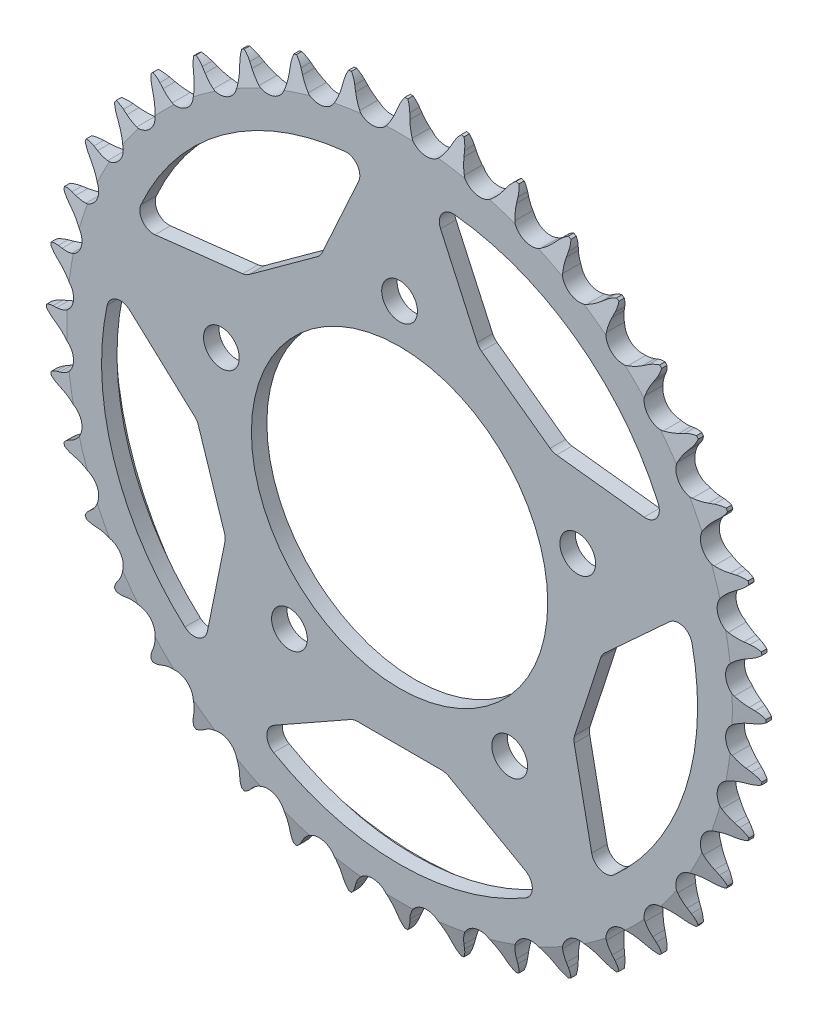
from build123d import *

# Parameters (mm, degrees)
CUT_EXTRUDE1_DEPTH      = 150.392064827
CIRPATTERN1_COUNT       = 40
CUT_EXTRUDE2_DEPTH      = 150.392064971
CUT_EXTRUDE2_DEPTH_BACK = 150.392064971
SKETCH3_OUTSIDE_W       = 272.992
SKETCH3_OUTSIDE_H       = 272.992
SKETCH3_OUTSIDE_R       = 105.664
SKETCH3_OUTSIDE_R_2     = 9.128125
SKETCH4_R               = 43.5
SKETCH4_R_2             = 5.25
CUT_EXTRUDE3_DEPTH      = 150.469008542
SKETCH5_R               = 88.9
CUT_EXTRUDE4_DEPTH      = 1


with BuildPart() as part:
    # Sketch1 → Revolve1 (revolve)
    with BuildSketch(Plane(origin=(0, 0, 0), x_dir=(0, 0, -1), z_dir=(1, 0, 0))):
        Polygon((2.7686, 0), (-2.7686, 0), (-2.7686, 97.680500093), (-0.784225, 105.618000093), (0.784225, 105.618000093), (2.7686, 97.680500093), align=None)
    revolve(axis=Axis((0, 0, -2.7686), (0, 0, 1)))

    # Sketch0 → Cut-Extrude1 (cut, symmetric)
    with BuildSketch(Plane.XY):
        with BuildLine():
            Line((14.490506305, -102.030654901), (13.889358736, -100.705432441))
            ThreePointArc((13.889358736, -100.705432441), (12.971330875, -99.018148468), (11.819348726, -97.481060478))
            ThreePointArc((11.819348726, -97.481060478), (7.533945641, -95.727855787), (3.575564617, -98.129860358))
            ThreePointArc((3.575564617, -98.129860358), (2.678218818, -99.828233955), (2.035442768, -101.63835586))
            Line((2.035442768, -101.63835586), (1.64900679, -103.041302831))
            ThreePointArc((1.64900679, -103.041302831), (-1.504766141, -107.55512866), (-6.798561297, -109.070595641))
            ThreePointArc((-6.798561297, -109.070595641), (8.574188346, -108.945392575), (23.777260006, -106.664226317))
            ThreePointArc((23.777260006, -106.664226317), (18.311568987, -105.995549262), (14.490506305, -102.030654901))
        make_face()
    cut_extrude1 = extrude(amount=CUT_EXTRUDE1_DEPTH, both=True, mode=Mode.SUBTRACT)

    # CirPattern1: Cut-Extrude1 ×40 about axis
    cirpattern1_axis = Axis((0, 0, -2.7686), (0, 0, -1))
    for i in range(1, CIRPATTERN1_COUNT):
        add(cut_extrude1.rotate(cirpattern1_axis, i * 360 / CIRPATTERN1_COUNT), mode=Mode.SUBTRACT)

    # Sketch3 outside → Cut-Extrude2 (cut, two sides: drawn at the far end of the back side and taken through both)
    # profile 1 of 2: a face of its own
    with BuildSketch(Plane.XY.offset(-CUT_EXTRUDE2_DEPTH_BACK)):
        Rectangle(SKETCH3_OUTSIDE_W, SKETCH3_OUTSIDE_H)
        Circle(SKETCH3_OUTSIDE_R, mode=Mode.SUBTRACT)
    # profile 2 of 2: a face of its own
    with BuildSketch(Plane.XY.offset(-CUT_EXTRUDE2_DEPTH_BACK)):
        Circle(SKETCH3_OUTSIDE_R_2)
    extrude(amount=CUT_EXTRUDE2_DEPTH + CUT_EXTRUDE2_DEPTH_BACK, mode=Mode.SUBTRACT)

    # Sketch4 → Cut-Extrude3 (cut, through all)
    with BuildSketch(Plane(origin=(0, 0, -2.7686), x_dir=(-1, 0, 0), z_dir=(0, 0, -1))):
        with BuildLine():
            ThreePointArc((14.396422166, -58.578252267), (13.446033811, -58.192338289), (12.428748275, -58.060817336))
            Line((12.428748275, -58.060817336), (-12.428748275, -58.060817336))
            ThreePointArc((-12.428748275, -58.060817336), (-13.446033811, -58.192338289), (-14.396422166, -58.578252267))
            Line((-14.396422166, -58.578252267), (-36.936123044, -71.313342656))
            ThreePointArc((-36.936123044, -71.313342656), (-38.968386294, -74.773483053), (-36.975046435, -78.256192012))
            ThreePointArc((-36.975046435, -78.256192012), (0, -88.201393135), (36.975046435, -78.256192012))
            ThreePointArc((36.975046435, -78.256192012), (38.968386294, -74.773483053), (36.936123044, -71.313342656))
            Line((36.936123044, -71.313342656), (14.396422166, -58.578252267))
        make_face()
        with BuildLine():
            ThreePointArc((-51.262489424, -31.793486564), (-51.189149573, -30.770359548), (-51.378424233, -29.7622213))
            Line((-51.378424233, -29.7622213), (-59.059813104, -6.121337228))
            ThreePointArc((-59.059813104, -6.121337228), (-59.499255482, -5.194483399), (-60.159967639, -4.409864339))
            Line((-60.159967639, -4.409864339), (-79.236908958, 13.091305701))
            ThreePointArc((-79.236908958, 13.091305701), (-83.155701912, 13.954860722), (-85.851979069, 10.982865605))
            ThreePointArc((-85.851979069, 10.982865605), (-83.884509688, -27.255729406), (-63.000143637, -59.347852099))
            ThreePointArc((-63.000143637, -59.347852099), (-59.071914695, -60.167414706), (-56.409129505, -57.165375314))
            Line((-56.409129505, -57.165375314), (-51.262489424, -31.793486564))
        make_face()
        with BuildLine():
            ThreePointArc((-46.078382978, 38.92879695), (-45.082668103, 39.175210242), (-44.182360739, 39.666752991))
            Line((-44.182360739, 39.666752991), (-24.072223593, 54.277622872))
            ThreePointArc((-24.072223593, 54.277622872), (-23.326528382, 54.981970994), (-22.784482597, 55.85280622))
            Line((-22.784482597, 55.85280622), (-12.034979856, 79.404214536))
            ThreePointArc((-12.034979856, 79.404214536), (-12.424663846, 83.398061288), (-16.084394632, 85.04397625))
            ThreePointArc((-16.084394632, 85.04397625), (-51.843478117, 71.356425974), (-75.911276498, 41.577202255))
            ThreePointArc((-75.911276498, 41.577202255), (-75.476837356, 37.587975749), (-71.798882354, 35.983197732))
            Line((-71.798882354, 35.983197732), (-46.078382978, 38.92879695))
        make_face()
        with BuildLine():
            ThreePointArc((22.784482597, 55.85280622), (23.326528382, 54.981970994), (24.072223593, 54.277622872))
            Line((24.072223593, 54.277622872), (44.182360739, 39.666752991))
            ThreePointArc((44.182360739, 39.666752991), (45.082668103, 39.175210242), (46.078382978, 38.92879695))
            Line((46.078382978, 38.92879695), (71.798882354, 35.983197732))
            ThreePointArc((71.798882354, 35.983197732), (75.476837356, 37.587975749), (75.911276498, 41.577202255))
            ThreePointArc((75.911276498, 41.577202255), (51.843478117, 71.356425974), (16.084394632, 85.04397625))
            ThreePointArc((16.084394632, 85.04397625), (12.424663846, 83.398061288), (12.034979856, 79.404214536))
            Line((12.034979856, 79.404214536), (22.784482597, 55.85280622))
        make_face()
        with BuildLine():
            ThreePointArc((60.159967639, -4.409864339), (59.499255482, -5.194483399), (59.059813104, -6.121337228))
            Line((59.059813104, -6.121337228), (51.378424233, -29.7622213))
            ThreePointArc((51.378424233, -29.7622213), (51.189149573, -30.770359548), (51.262489424, -31.793486564))
            Line((51.262489424, -31.793486564), (56.409129505, -57.165375314))
            ThreePointArc((56.409129505, -57.165375314), (59.071914695, -60.167414706), (63.000143637, -59.347852099))
            ThreePointArc((63.000143637, -59.347852099), (83.884509688, -27.255729406), (85.851979069, 10.982865605))
            ThreePointArc((85.851979069, 10.982865605), (83.155701912, 13.954860722), (79.236908958, 13.091305701))
            Line((79.236908958, 13.091305701), (60.159967639, -4.409864339))
        make_face()
        Circle(SKETCH4_R)
        with Locations((0, 55)):
            Circle(SKETCH4_R_2)
        with Locations((52.308108396, 16.995934691)):
            Circle(SKETCH4_R_2)
        with Locations((32.328188876, -44.495934691)):
            Circle(SKETCH4_R_2)
        with Locations((-32.328188876, -44.495934691)):
            Circle(SKETCH4_R_2)
        with Locations((-52.308108396, 16.995934691)):
            Circle(SKETCH4_R_2)
    extrude(amount=-CUT_EXTRUDE3_DEPTH, mode=Mode.SUBTRACT)

    # Sketch5 → Cut-Extrude4 (cut)
    with BuildSketch(Plane(origin=(0, 0, -2.7686), x_dir=(-1, 0, 0), z_dir=(0, 0, -1))):
        Circle(SKETCH5_R)
    extrude(amount=-CUT_EXTRUDE4_DEPTH, mode=Mode.SUBTRACT)


solid = part.part
